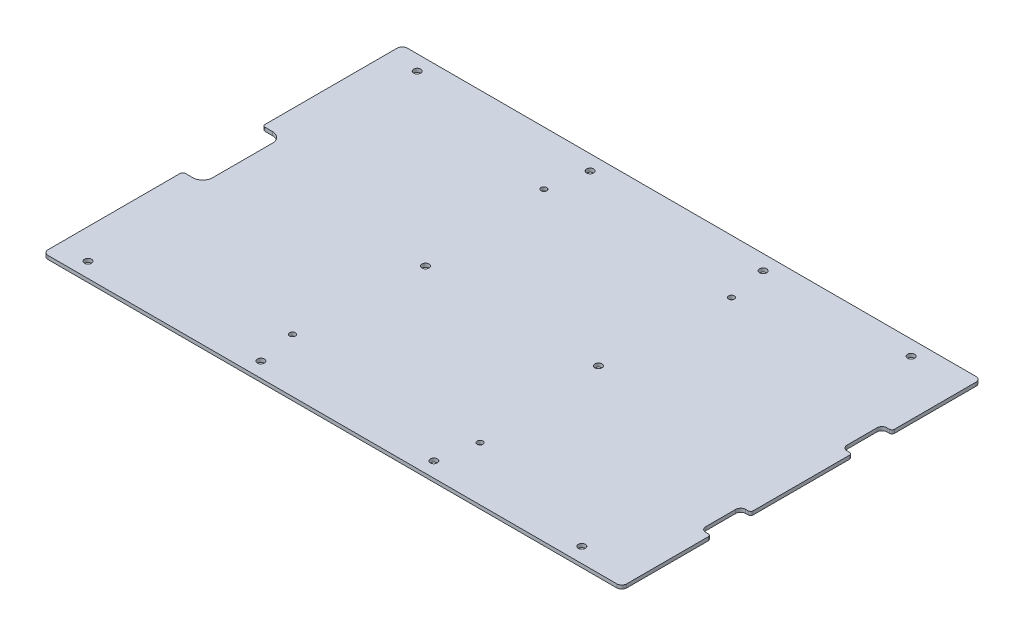
from build123d import *

# Parameters (mm, degrees)
SKETCH1_R           = 2.2479
SKETCH1_R_2         = 1.8288
BOSS_EXTRUDE1_DEPTH = 2.286
CUT_EXTRUDE1_DEPTH  = 217.750866886
FILLET1_R           = 1.5875


with BuildPart() as part:
    # Sketch1 → Boss-Extrude1 (new body)
    with BuildSketch(Plane(origin=(0, 0, 0), x_dir=(1, 0, 0), z_dir=(0, 1, 0))):
        with BuildLine():
            Line((-180.975, 114.3), (180.975, 114.3))
            ThreePointArc((180.975, 114.3), (183.22006403, 113.37006403), (184.15, 111.125))
            Line((184.15, 111.125), (184.15, -111.125))
            ThreePointArc((184.15, -111.125), (183.22006403, -113.37006403), (180.975, -114.3))
            Line((180.975, -114.3), (-180.975, -114.3))
            ThreePointArc((-180.975, -114.3), (-183.22006403, -113.37006403), (-184.15, -111.125))
            Line((-184.15, -111.125), (-184.15, 111.125))
            ThreePointArc((-184.15, 111.125), (-183.22006403, 113.37006403), (-180.975, 114.3))
        make_face()
        with Locations((-165.1, 104.775)):
            Circle(SKETCH1_R, mode=Mode.SUBTRACT)
        with Locations((-55.033333333, 104.775)):
            Circle(SKETCH1_R, mode=Mode.SUBTRACT)
        with Locations((55.033333333, 104.775)):
            Circle(SKETCH1_R, mode=Mode.SUBTRACT)
        with Locations((55.033333333, -104.775)):
            Circle(SKETCH1_R, mode=Mode.SUBTRACT)
        with Locations((-55.033333333, -104.775)):
            Circle(SKETCH1_R, mode=Mode.SUBTRACT)
        with Locations((-165.1, -104.775)):
            Circle(SKETCH1_R, mode=Mode.SUBTRACT)
        with Locations((-55.033333333, 0)):
            Circle(SKETCH1_R, mode=Mode.SUBTRACT)
        with Locations((55.033333333, 0)):
            Circle(SKETCH1_R, mode=Mode.SUBTRACT)
        with Locations((149.225, -104.775)):
            Circle(SKETCH1_R, mode=Mode.SUBTRACT)
        with Locations((149.225, 104.775)):
            Circle(SKETCH1_R, mode=Mode.SUBTRACT)
        with Locations((59.69, -80.01)):
            Circle(SKETCH1_R_2, mode=Mode.SUBTRACT)
        with Locations((-59.69, -80.01)):
            Circle(SKETCH1_R_2, mode=Mode.SUBTRACT)
        with Locations((-59.69, 80.01)):
            Circle(SKETCH1_R_2, mode=Mode.SUBTRACT)
        with Locations((59.69, 80.01)):
            Circle(SKETCH1_R_2, mode=Mode.SUBTRACT)
    extrude(amount=BOSS_EXTRUDE1_DEPTH)

    # Sketch2 → Cut-Extrude1 (cut, through all)
    with BuildSketch(Plane.XZ):
        with BuildLine():
            Line((184.15, 57.658), (180.975, 57.658))
            ThreePointArc((180.975, 57.658), (178.72993597, 56.72806403), (177.8, 54.483))
            Line((177.8, 54.483), (177.8, 35.433))
            ThreePointArc((177.8, 35.433), (178.72993597, 33.18793597), (180.975, 32.258))
            Line((180.975, 32.258), (184.15, 32.258))
            Line((184.15, 32.258), (184.15, 57.658))
        make_face()
        with BuildLine():
            Line((184.15, -32.258), (180.975, -32.258))
            ThreePointArc((180.975, -32.258), (178.72993597, -33.18793597), (177.8, -35.433))
            Line((177.8, -35.433), (177.8, -54.483))
            ThreePointArc((177.8, -54.483), (178.72993597, -56.72806403), (180.975, -57.658))
            Line((180.975, -57.658), (184.15, -57.658))
            Line((184.15, -57.658), (184.15, -32.258))
        make_face()
        with BuildLine():
            Line((-184.15, 25.4), (-177.8, 25.4))
            ThreePointArc((-177.8, 25.4), (-173.309871939, 23.540128061), (-171.45, 19.05))
            Line((-171.45, 19.05), (-171.45, -19.05))
            ThreePointArc((-171.45, -19.05), (-173.309871939, -23.540128061), (-177.8, -25.4))
            Line((-177.8, -25.4), (-184.15, -25.4))
            Line((-184.15, -25.4), (-184.15, 25.4))
        make_face()
    extrude(amount=-CUT_EXTRUDE1_DEPTH, mode=Mode.SUBTRACT)

    # Fillet1
    fillet1_edges = [part.edges().sort_by_distance(p)[0] for p in [
        (184.15, 1.143, -57.658),
        (184.15, 1.143, -32.258),
        (184.15, 1.143, 32.258),
        (184.15, 1.143, 57.658),
        (-184.15, 1.143, -25.4),
        (-184.15, 1.143, 25.4),
    ]]
    fillet(fillet1_edges, radius=FILLET1_R)


solid = part.part
